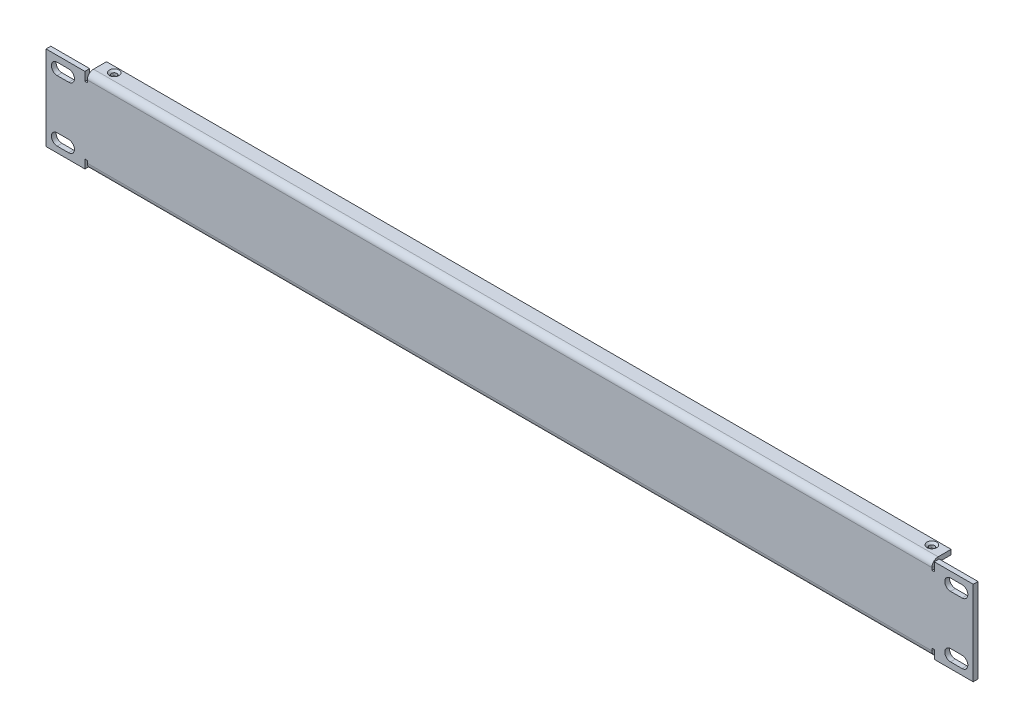
from build123d import *

# Parameters (mm, degrees)
SKETCH1_W                                         = 241.3
SKETCH1_H                                         = 22
BASE_FLANGE_DEPTH                                 = 2.5
EDGE_FLANGE_MOUNING_STRIP_W                       = 11.4732
EDGE_FLANGE_MOUNING_STRIP_H                       = 2.5
EDGE_FLANGE_MOUNING_STRIP_CUT_DEPTH               = 219.8
EDGE_FLANGE_MOUNING_RELIEF_W                      = 12.7232
EDGE_FLANGE_MOUNING_RELIEF_H                      = 1.25
EDGE_FLANGE_MOUNING_RELIEF_CUT_DEPTH              = 2.5
EDGE_FLANGE_MOUNING_DEPTH                         = 219.8
CUT_EXTRUDE_MOUNTING_DEPTH                        = 2.5
CSK_FOR_3_FLAT_HEAD_MACHINE_SCREW_100_D           = 2.794
CSK_FOR_3_FLAT_HEAD_MACHINE_SCREW_100_CSINK_D     = 5.0546
CSK_FOR_3_FLAT_HEAD_MACHINE_SCREW_100_CSINK_ANGLE = 100


# Sheet-metal steps are written as plain solids
with BuildPart() as part:
    # Sketch1 → Base-Flange (new body)
    with BuildSketch(Plane.XY):
        with Locations((-120.65, 11)):
            Rectangle(SKETCH1_W, SKETCH1_H)
    extrude(amount=-BASE_FLANGE_DEPTH)

    # Edge-Flange-Mouning strip (across the edge) → Edge-Flange-Mouning strip cut (cut)
    with BuildSketch(Plane(origin=(-219.8, 22, -2.5), x_dir=(0, -1, 0), z_dir=(1, 0, 0))):
        with Locations((-2.5, -1.25)):
            Rectangle(EDGE_FLANGE_MOUNING_STRIP_W, EDGE_FLANGE_MOUNING_STRIP_H)
    extrude(amount=EDGE_FLANGE_MOUNING_STRIP_CUT_DEPTH, mode=Mode.SUBTRACT)

    # Edge-Flange-Mouning relief (on the sheet) → Edge-Flange-Mouning relief cut (cut)
    with BuildSketch(Plane(origin=(-219.8, 18.7634, -2.5), x_dir=(0, -1, 0), z_dir=(0, 0, -1))):
        with Locations((-5.1116, 0.625)):
            Rectangle(EDGE_FLANGE_MOUNING_RELIEF_W, EDGE_FLANGE_MOUNING_RELIEF_H)
    extrude(amount=-EDGE_FLANGE_MOUNING_RELIEF_CUT_DEPTH, mode=Mode.SUBTRACT)

    # Edge-Flange-Mouning section (across the edge) → Edge-Flange-Mouning (add)
    with BuildSketch(Plane(origin=(-219.8, 22, -2.5), x_dir=(0, -1, 0), z_dir=(1, 0, 0))):
        with BuildLine():
            Line((0, 0.7366), (0, 7.5))
            Line((0, 7.5), (2.5, 7.5))
            Line((2.5, 7.5), (2.5, 0.7366))
            ThreePointArc((2.5, 0.7366), (2.715745145, 0.215745145), (3.2366, 0))
            Line((3.2366, 0), (3.2366, -2.5))
            ThreePointArc((3.2366, -2.5), (0.947978192, -1.552021808), (0, 0.7366))
        make_face()
    extrude(amount=EDGE_FLANGE_MOUNING_DEPTH)

    # Sketch13 → Cut-Extrude-Mounting (cut)
    with BuildSketch(Plane.XY):
        with BuildLine():
            Line((-229.5, 12.9), (-235.5, 12.9))
            ThreePointArc((-235.5, 12.9), (-238.5, 15.9), (-235.5, 18.9))
            Line((-235.5, 18.9), (-229.5, 18.9))
            ThreePointArc((-229.5, 18.9), (-226.5, 15.9), (-229.5, 12.9))
        make_face()
    extrude(amount=-CUT_EXTRUDE_MOUNTING_DEPTH, mode=Mode.SUBTRACT)

    # CSK for #3 Flat Head Machine Screw (100)1 (through all)
    with Locations(Plane(origin=(0, 22, 0), x_dir=(1, 0, 0), z_dir=(0, 1, 0))):
        with Locations((-212.8, 7)):
            CounterSinkHole(CSK_FOR_3_FLAT_HEAD_MACHINE_SCREW_100_D / 2, CSK_FOR_3_FLAT_HEAD_MACHINE_SCREW_100_CSINK_D / 2, counter_sink_angle=CSK_FOR_3_FLAT_HEAD_MACHINE_SCREW_100_CSINK_ANGLE)

    # Mirror-Vertical: part across plane


with BuildPart() as part_1:
    add(part.part)
    add(part.part.mirror(Plane(origin=(0, 0, -2.5), x_dir=(0, 0, 1), z_dir=(1, 0, 0))))

    # Mirror-Horizontal: part across face


with BuildPart() as part_2:
    add(part_1.part)
    add(part_1.part.mirror(Plane(origin=(0, 0, -1.25), x_dir=(0, 0, 1), z_dir=(0, -1, 0))))


solid = part_2.part
